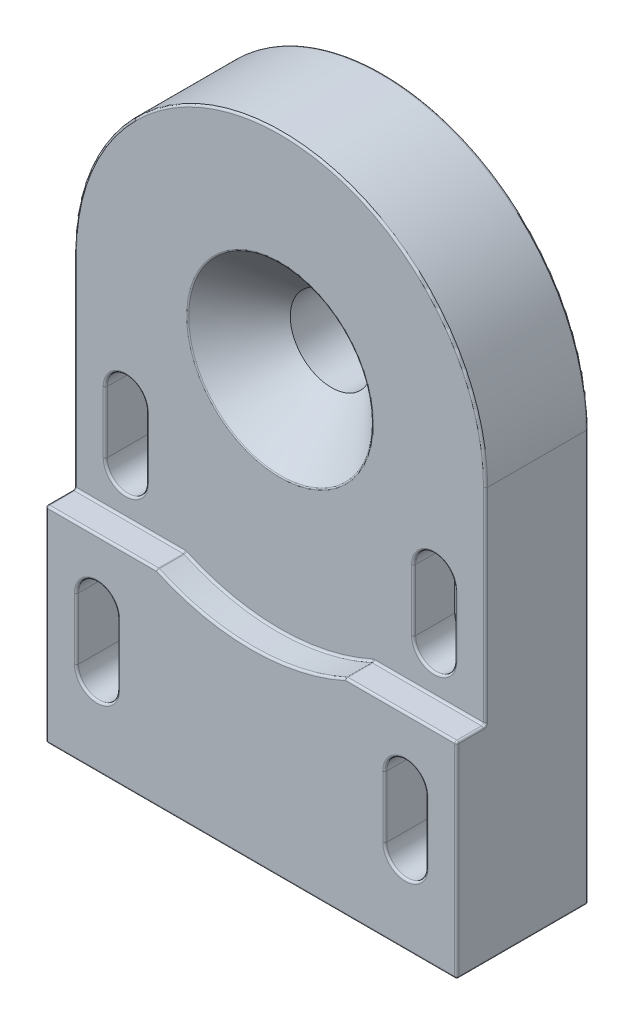
from build123d import *

# Parameters (mm, degrees)
SKETCH1_W           = 20
SKETCH1_H           = 30
SKETCH1_R           = 2
BOSS_EXTRUDE1_DEPTH = 5
CHAMFER1_SIZE       = 2.5
BOSS_EXTRUDE2_DEPTH = 1.4
CUT_EXTRUDE1_DEPTH  = 3
CHAMFER2_SIZE       = 0.5
CUT_EXTRUDE2_DEPTH  = 23.912878475
FILLET1_R           = 0.1


with BuildPart() as part:
    # Sketch1 → Boss-Extrude1 (new body)
    with BuildSketch(Plane.XY):
        with Locations((0, -5)):
            Rectangle(SKETCH1_W, SKETCH1_H)
        Circle(SKETCH1_R, mode=Mode.SUBTRACT)
        with BuildLine():
            Line((-6.5, -13), (-6.5, -16))
            ThreePointArc((-6.5, -16), (-7.5, -17), (-8.5, -16))
            Line((-8.5, -16), (-8.5, -13))
            ThreePointArc((-8.5, -13), (-7.5, -12), (-6.5, -13))
        make_face(mode=Mode.SUBTRACT)
        with BuildLine():
            Line((6.5, -13), (6.5, -16))
            ThreePointArc((6.5, -16), (7.5, -17), (8.5, -16))
            Line((8.5, -16), (8.5, -13))
            ThreePointArc((8.5, -13), (7.5, -12), (6.5, -13))
        make_face(mode=Mode.SUBTRACT)
        with BuildLine():
            Line((-8.5, -5), (-8.5, -8))
            ThreePointArc((-8.5, -8), (-7.5, -9), (-6.5, -8))
            Line((-6.5, -8), (-6.5, -5))
            ThreePointArc((-6.5, -5), (-7.5, -4), (-8.5, -5))
        make_face(mode=Mode.SUBTRACT)
        with BuildLine():
            Line((6.5, -5), (6.5, -8))
            ThreePointArc((6.5, -8), (7.5, -9), (8.5, -8))
            Line((8.5, -8), (8.5, -5))
            ThreePointArc((8.5, -5), (7.5, -4), (6.5, -5))
        make_face(mode=Mode.SUBTRACT)
    extrude(amount=BOSS_EXTRUDE1_DEPTH)

    # Chamfer1
    chamfer1_edges = [part.edges().sort_by_distance(p)[0] for p in [
        (-2, 0, 5),
    ]]
    chamfer(chamfer1_edges, length=CHAMFER1_SIZE)

    # Sketch2 → Boss-Extrude2 (add)
    with BuildSketch(Plane.XY.offset(5)):
        with BuildLine():
            Line((-10, -20), (10, -20))
            Line((10, -20), (10, -10))
            Line((10, -10), (4.582575695, -10))
            ThreePointArc((4.582575695, -10), (0, -11), (-4.582575695, -10))
            Line((-4.582575695, -10), (-10, -10))
            Line((-10, -10), (-10, -20))
        make_face()
        with BuildLine():
            Line((-8.5, -13), (-8.5, -16))
            ThreePointArc((-8.5, -16), (-7.5, -17), (-6.5, -16))
            Line((-6.5, -16), (-6.5, -13))
            ThreePointArc((-6.5, -13), (-7.5, -12), (-8.5, -13))
        make_face(mode=Mode.SUBTRACT)
        with BuildLine():
            Line((8.5, -16), (8.5, -13))
            ThreePointArc((8.5, -13), (7.5, -12), (6.5, -13))
            Line((6.5, -13), (6.5, -16))
            ThreePointArc((6.5, -16), (7.5, -17), (8.5, -16))
        make_face(mode=Mode.SUBTRACT)
    extrude(amount=BOSS_EXTRUDE2_DEPTH)

    # Sketch3 → Cut-Extrude1 (cut)
    with BuildSketch(Plane(origin=(0, 0, 0), x_dir=(-1, 0, 0), z_dir=(0, 0, -1))):
        with BuildLine():
            Line((-7.5, -12), (7.5, -12))
            ThreePointArc((7.5, -12), (8.207106781, -12.292893219), (8.5, -13))
            Line((8.5, -13), (8.5, -16))
            ThreePointArc((8.5, -16), (8.207106781, -16.707106781), (7.5, -17))
            Line((7.5, -17), (-7.5, -17))
            ThreePointArc((-7.5, -17), (-8.207106781, -16.707106781), (-8.5, -16))
            Line((-8.5, -16), (-8.5, -13))
            ThreePointArc((-8.5, -13), (-8.207106781, -12.292893219), (-7.5, -12))
        make_face()
        with BuildLine():
            Line((-8.5, -8), (-8.5, -5))
            ThreePointArc((-8.5, -5), (-8.207106781, -4.292893219), (-7.5, -4))
            Line((-7.5, -4), (7.5, -4))
            ThreePointArc((7.5, -4), (8.207106781, -4.292893219), (8.5, -5))
            Line((8.5, -5), (8.5, -8))
            ThreePointArc((8.5, -8), (8.207106781, -8.707106781), (7.5, -9))
            Line((7.5, -9), (-7.5, -9))
            ThreePointArc((-7.5, -9), (-8.207106781, -8.707106781), (-8.5, -8))
        make_face()
    extrude(amount=-CUT_EXTRUDE1_DEPTH, mode=Mode.SUBTRACT)

    # Chamfer2
    # the kernel refuses this chamfer: 0.5 mm, written as the material it adds along each edge
    with BuildSketch(Plane(origin=(8.785841494, -12, 3), x_dir=(0, -0.9996219169112968, 0.02749587661058651), z_dir=(-1, 0, 0))) as chamfer2_piece_1_section:
        Polygon((CHAMFER2_SIZE * 0.999621916911, -CHAMFER2_SIZE * 0.0274958766106), (-CHAMFER2_SIZE * 0.0274958766106, -CHAMFER2_SIZE * 0.999621916911), (0, 0), align=None)
    chamfer2_piece_1 = extrude(amount=17.571682988, mode=Mode.PRIVATE)
    chamfer2_piece_1 = chamfer2_piece_1 - Plane(origin=(7.5, -13, 2.831391478), x_dir=(1, 0, 0), z_dir=(0, 0, -1)) * Cylinder(1, 38, mode=Mode.PRIVATE)
    chamfer2_piece_1 = chamfer2_piece_1 - Plane(origin=(-7.5, -13, 2.831391478), x_dir=(-1, 0, 0), z_dir=(0, 0, -1)) * Cylinder(1, 38, mode=Mode.PRIVATE)
    add(chamfer2_piece_1)
    with BuildSketch(Plane(origin=(-8.785841494, -17, 3), x_dir=(0, 0.9996219169112968, 0.027495876610586414), z_dir=(1, 0, 0))) as chamfer2_piece_2_section:
        Polygon((CHAMFER2_SIZE * 0.999621916911, -CHAMFER2_SIZE * 0.0274958766106), (-CHAMFER2_SIZE * 0.0274958766106, -CHAMFER2_SIZE * 0.999621916911), (0, 0), align=None)
    chamfer2_piece_2 = extrude(amount=17.571682988, mode=Mode.PRIVATE)
    chamfer2_piece_2 = chamfer2_piece_2 - Plane(origin=(7.5, -16, 2.831391478), x_dir=(-1, 0, 0), z_dir=(0, 0, -1)) * Cylinder(1, 38, mode=Mode.PRIVATE)
    chamfer2_piece_2 = chamfer2_piece_2 - Plane(origin=(-7.5, -16, 2.831391478), x_dir=(1, 0, 0), z_dir=(0, 0, -1)) * Cylinder(1, 38, mode=Mode.PRIVATE)
    add(chamfer2_piece_2)
    with BuildSketch(Plane(origin=(8.785841494, -4, 3), x_dir=(0, 0.027495876610586487, -0.9996219169112968), z_dir=(-1, 0, 0))) as chamfer2_piece_3_section:
        Polygon((CHAMFER2_SIZE * 0.999621916911, CHAMFER2_SIZE * 0.0274958766106), (-CHAMFER2_SIZE * 0.0274958766106, CHAMFER2_SIZE * 0.999621916911), (0, 0), align=None)
    chamfer2_piece_3 = extrude(amount=17.571682988, mode=Mode.PRIVATE)
    chamfer2_piece_3 = chamfer2_piece_3 - Plane(origin=(-7.5, -5, 2.831391479), x_dir=(1, 0, 0), z_dir=(0, 0, -1)) * Cylinder(1, 38, mode=Mode.PRIVATE)
    chamfer2_piece_3 = chamfer2_piece_3 - Plane(origin=(7.5, -5, 2.831391479), x_dir=(1, 0, 0), z_dir=(0, 0, -1)) * Cylinder(1, 38, mode=Mode.PRIVATE)
    add(chamfer2_piece_3)
    with BuildSketch(Plane(origin=(-8.785841494, -9, 3), x_dir=(0, 0.9996219169112968, 0.02749587661058651), z_dir=(1, 0, 0))) as chamfer2_piece_4_section:
        Polygon((CHAMFER2_SIZE * 0.999621916911, -CHAMFER2_SIZE * 0.0274958766106), (-CHAMFER2_SIZE * 0.0274958766106, -CHAMFER2_SIZE * 0.999621916911), (0, 0), align=None)
    chamfer2_piece_4 = extrude(amount=17.571682988, mode=Mode.PRIVATE)
    chamfer2_piece_4 = chamfer2_piece_4 - Plane(origin=(-7.5, -8, 2.831391478), x_dir=(-1, 0, 0), z_dir=(0, 0, -1)) * Cylinder(1, 38, mode=Mode.PRIVATE)
    chamfer2_piece_4 = chamfer2_piece_4 - Plane(origin=(7.5, -8, 2.831391478), x_dir=(-1, 0, 0), z_dir=(0, 0, -1)) * Cylinder(1, 38, mode=Mode.PRIVATE)
    add(chamfer2_piece_4)

    # Sketch6 → Cut-Extrude2 (cut, through all)
    with BuildSketch(Plane.XY.offset(5)):
        with BuildLine():
            ThreePointArc((-10, 0), (-7.071067803, 7.071067821), (2.6e-08, 10))
            Line((2.6e-08, 10), (-10, 10))
            Line((-10, 10), (-10, 0))
        make_face()
        with BuildLine():
            Line((10, 0), (10, 10))
            Line((10, 10), (2.6e-08, 10))
            ThreePointArc((2.6e-08, 10), (7.071067821, 7.071067803), (10, 0))
        make_face()
    extrude(amount=-CUT_EXTRUDE2_DEPTH, mode=Mode.SUBTRACT)

    # Fillet1
    fillet1_edges = [part.edges().sort_by_distance(p)[0] for p in [
        (-10, -10, 0),
        (-10, -5, 5),
        (0, 10, 5),
        (0, 10, 0),
        (-7.5, -4, 5),
        (-8.5, -6.5, 5),
        (-7.5, -9, 5),
        (-6.5, -6.5, 5),
        (10, -10, 0),
        (0, -20, 0),
        (7.5, -4, 5),
        (6.5, -6.5, 5),
        (7.5, -9, 5),
        (8.5, -6.5, 5),
        (-4.5, 0, 5),
        (10, -20, 3.2),
        (-10, -20, 3.2),
        (10, -5, 5),
        (-10, -15, 6.4),
        (0, -20, 6.4),
        (10, -15, 6.4),
        (7.291287847, -10, 6.4),
        (0, -11, 6.4),
        (-7.291287847, -10, 6.4),
        (-10, -10, 5.7),
        (7.291287847, -10, 5),
        (10, -10, 5.7),
        (0, -11, 5),
        (4.582575695, -10, 5.7),
        (-7.291287847, -10, 5),
        (-4.582575695, -10, 5.7),
        (7.5, -17, 6.4),
        (8.5, -14.5, 6.4),
        (7.5, -12, 6.4),
        (6.5, -14.5, 6.4),
        (-7.5, -17, 6.4),
        (-6.5, -14.5, 6.4),
        (-7.5, -12, 6.4),
        (-8.5, -14.5, 6.4),
    ]]
    fillet(fillet1_edges, radius=FILLET1_R)


solid = part.part
